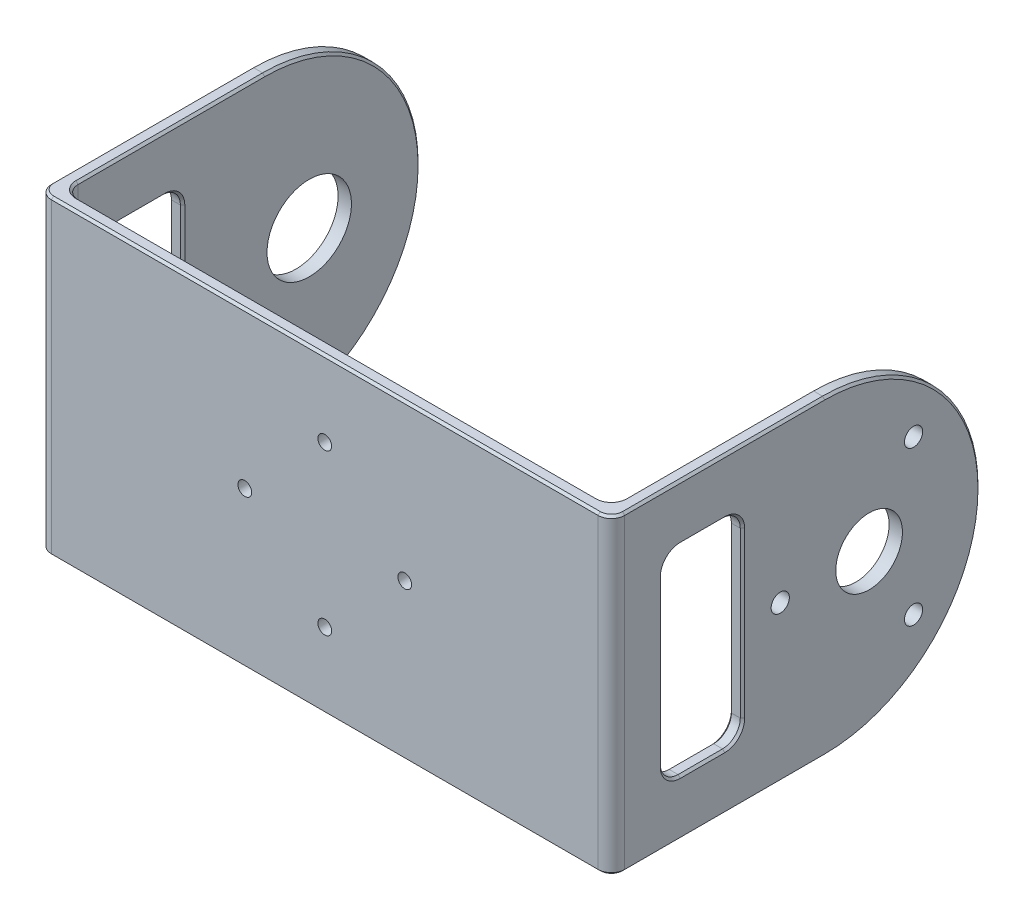
from build123d import *

# Parameters (mm, degrees)
F_70MM_DEPTH            = 70
FILLET_1_R              = 3
CUT_EXTRUDE_1_REACH     = 170.612
SKETCH_2_R              = 2.05
SKETCH_2_R_2            = 7.5
CUT_EXTRUDE_2_REACH     = 170.612
SKETCH_3_R              = 9.5
SKETCH_4_W              = 18
SKETCH_4_H              = 45
CUT_EXTRUDE_3_DEPTH     = 169.611980594
FILLET_2_R              = 4
FILLET_3_R              = 35
HOLE_WIZARD_3_1_3_1_1_D = 3.1
CHAMFER_1_SIZE          = 0.5


with BuildPart() as part:
    # 草图1 → 宽70mm (new body)
    with BuildSketch(Plane(origin=(0, 0, 0), x_dir=(1, 0, 0), z_dir=(0, 1, 0))):
        Polygon((-64.5, 0), (64.5, 0), (64.5, 83), (61.5, 83), (61.5, 3), (-61.5, 3), (-61.5, 83), (-64.5, 83), align=None)
    extrude(amount=F_70MM_DEPTH)

    # 圆角1
    fillet_1_edges = [part.edges().sort_by_distance(p)[0] for p in [
        (64.5, 35, 0),
        (-64.5, 35, 0),
        (-61.5, 35, -3),
        (61.5, 35, -3),
    ]]
    fillet(fillet_1_edges, radius=FILLET_1_R)

    # 草图2 → 切除-拉伸1 (cut, up to next)
    with BuildSketch(Plane(origin=(64.5, 0, 0), x_dir=(0, 0, -1), z_dir=(1, 0, 0)), mode=Mode.PRIVATE) as cut_extrude_1_sk1:
        with Locations((38, 35)):
            Circle(SKETCH_2_R)
    cut_extrude_1_tool1 = extrude(cut_extrude_1_sk1.sketch, amount=-CUT_EXTRUDE_1_REACH, mode=Mode.PRIVATE) & part.part
    # 草图2 → 切除-拉伸1 (cut, up to next)
    with BuildSketch(Plane(origin=(64.5, 0, 0), x_dir=(0, 0, -1), z_dir=(1, 0, 0)), mode=Mode.PRIVATE) as cut_extrude_1_sk2:
        with Locations((68, 52.320508076)):
            Circle(SKETCH_2_R)
    cut_extrude_1_tool2 = extrude(cut_extrude_1_sk2.sketch, amount=-CUT_EXTRUDE_1_REACH, mode=Mode.PRIVATE) & part.part
    # 草图2 → 切除-拉伸1 (cut, up to next)
    with BuildSketch(Plane(origin=(64.5, 0, 0), x_dir=(0, 0, -1), z_dir=(1, 0, 0)), mode=Mode.PRIVATE) as cut_extrude_1_sk3:
        with Locations((68, 17.679491924)):
            Circle(SKETCH_2_R)
    cut_extrude_1_tool3 = extrude(cut_extrude_1_sk3.sketch, amount=-CUT_EXTRUDE_1_REACH, mode=Mode.PRIVATE) & part.part
    # 草图2 → 切除-拉伸1 (cut, up to next)
    with BuildSketch(Plane(origin=(64.5, 0, 0), x_dir=(0, 0, -1), z_dir=(1, 0, 0)), mode=Mode.PRIVATE) as cut_extrude_1_sk4:
        with Locations((58, 35)):
            Circle(SKETCH_2_R_2)
    cut_extrude_1_tool4 = extrude(cut_extrude_1_sk4.sketch, amount=-CUT_EXTRUDE_1_REACH, mode=Mode.PRIVATE) & part.part
    add(cut_extrude_1_tool1.solids().sort_by_distance((64.5, 35, -38))[0], mode=Mode.SUBTRACT)
    add(cut_extrude_1_tool2.solids().sort_by_distance((64.5, 52.320508, -68))[0], mode=Mode.SUBTRACT)
    add(cut_extrude_1_tool3.solids().sort_by_distance((64.5, 17.679492, -68))[0], mode=Mode.SUBTRACT)
    add(cut_extrude_1_tool4.solids().sort_by_distance((64.5, 35, -58))[0], mode=Mode.SUBTRACT)

    # 草图3 → 切除-拉伸2 (cut, up to next)
    with BuildSketch(Plane.ZY.offset(64.5), mode=Mode.PRIVATE) as cut_extrude_2_sk1:
        with Locations((-58, 35)):
            Circle(SKETCH_3_R)
    cut_extrude_2_tool1 = extrude(cut_extrude_2_sk1.sketch, amount=-CUT_EXTRUDE_2_REACH, mode=Mode.PRIVATE) & part.part
    add(cut_extrude_2_tool1.solids().sort_by_distance((-64.5, 35, -58))[0], mode=Mode.SUBTRACT)

    # 草图4 → 切除-拉伸3 (cut, through all)
    with BuildSketch(Plane(origin=(64.5, 0, 0), x_dir=(0, 0, -1), z_dir=(1, 0, 0))):
        with Locations((20.5, 35)):
            Rectangle(SKETCH_4_W, SKETCH_4_H)
    extrude(amount=-CUT_EXTRUDE_3_DEPTH, mode=Mode.SUBTRACT)

    # 圆角2
    fillet_2_edges = [part.edges().sort_by_distance(p)[0] for p in [
        (63, 57.5, -29.5),
        (-63, 57.5, -29.5),
        (63, 12.5, -29.5),
        (-63, 12.5, -29.5),
        (63, 12.5, -11.5),
        (-63, 12.5, -11.5),
        (63, 57.5, -11.5),
        (-63, 57.5, -11.5),
    ]]
    fillet(fillet_2_edges, radius=FILLET_2_R)

    # 圆角3
    fillet_3_edges = [part.edges().sort_by_distance(p)[0] for p in [
        (63, 70, -83),
        (-63, 70, -83),
        (-63, 0, -83),
        (63, 0, -83),
    ]]
    fillet(fillet_3_edges, radius=FILLET_3_R - 0.0001)  # a hair under: the kernel refuses the full size

    # Ø3.1 (3.1) 直径孔1 (through all)
    with Locations(Plane(origin=(0, 53, -3), x_dir=(-1, 0, 0), z_dir=(0, 0, -1))):
        with Locations((0, 0), (-18, -18), (0, -36), (18, -18)):
            Hole(HOLE_WIZARD_3_1_3_1_1_D / 2)

    # 倒角1
    chamfer_1_edges = [part.edges().sort_by_distance(p)[0] for p in [
        (-64.5, 35, -29.5),
        (-61.5, 35, -29.5),
        (-64.5, 35, -11.5),
        (-61.5, 35, -11.5),
        (-64.5, 12.5, -20.5),
        (-61.5, 12.5, -20.5),
        (64.5, 35, -29.5),
        (61.5, 35, -29.5),
        (64.5, 12.5, -20.5),
        (61.5, 12.5, -20.5),
        (64.5, 57.5, -20.5),
        (61.5, 57.5, -20.5),
        (64.5, 35, -11.5),
        (61.5, 35, -11.5),
        (-61.5, 56.328427125, -28.328427125),
        (-64.5, 56.328427125, -28.328427125),
        (-61.5, 56.328427125, -12.671572875),
        (-64.5, 56.328427125, -12.671572875),
        (-61.5, 13.671572875, -28.328427125),
        (-64.5, 13.671572875, -28.328427125),
        (-61.5, 13.671572875, -12.671572875),
        (-64.5, 13.671572875, -12.671572875),
        (64.5, 13.671572875, -28.328427125),
        (61.5, 13.671572875, -28.328427125),
        (64.5, 56.328427125, -28.328427125),
        (61.5, 56.328427125, -28.328427125),
        (64.5, 13.671572875, -12.671572875),
        (61.5, 13.671572875, -12.671572875),
        (64.5, 56.328427125, -12.671572875),
        (61.5, 56.328427125, -12.671572875),
        (61.5, 70, -27.00005),
        (-64.5, 70, -25.50005),
        (61.5, 0, -27.00005),
        (61.5, 10.251233369, -72.748766631),
        (61.5, 59.748766631, -72.748766631),
        (64.5, 10.251233369, -72.748766631),
        (64.5, 59.748766631, -72.748766631),
        (-64.5, 0, -25.50005),
        (-64.5, 10.251233369, -72.748766631),
        (-64.5, 59.748766631, -72.748766631),
        (-61.5, 10.251233369, -72.748766631),
        (-61.5, 59.748766631, -72.748766631),
        (64.5, 0, -25.50005),
        (64.5, 70, -25.50005),
        (0, 0, 0),
        (-61.5, 0, -27.00005),
        (0, 0, -3),
        (-63.621320344, 0, -0.878679656),
        (63.621320344, 0, -0.878679656),
        (0, 70, 0),
        (0, 70, -3),
        (-61.5, 70, -27.00005),
        (-63.621320344, 70, -0.878679656),
        (63.621320344, 70, -0.878679656),
        (-60.621320344, 0, -3.878679656),
        (-60.621320344, 70, -3.878679656),
        (60.621320344, 0, -3.878679656),
        (60.621320344, 70, -3.878679656),
        (-64.5, 57.5, -20.5),
        (-61.5, 57.5, -20.5),
    ]]
    chamfer(chamfer_1_edges, length=CHAMFER_1_SIZE)


solid = part.part
